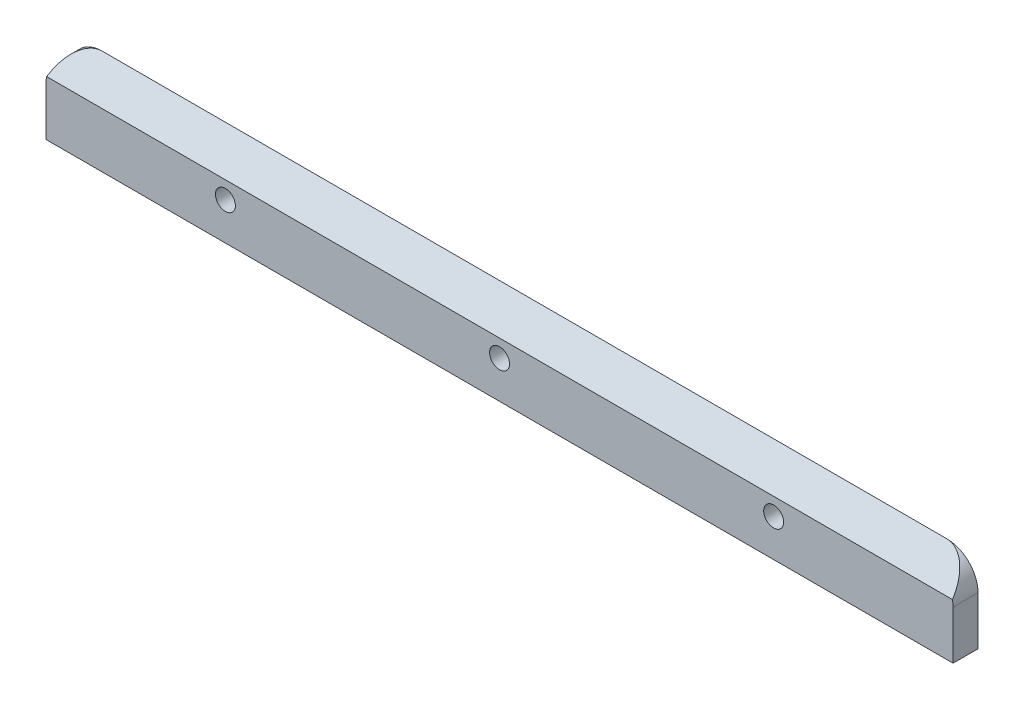
from build123d import *

# Parameters (mm, degrees)
SKETCH1_W                 = 2
SKETCH1_H                 = 6.4
BOSS_EXTRUDE1_DEPTH       = 36.4
FILLET3_R                 = 2.5
M2X0_4_TAPPED_HOLE1_D     = 1.6
M2X0_4_TAPPED_HOLE1_DEPTH = 3.6
M2X0_4_TAPPED_HOLE1_TIP   = 0.480688495
CUT_EXTRUDE7_DEPTH        = 37.595081637
CUT_EXTRUDE7_DEPTH_BACK   = 37.595081637


with BuildPart() as part:
    # Sketch1 → Boss-Extrude1 (new, symmetric)
    with BuildSketch(Plane(origin=(0, 0, 0), x_dir=(0, 0, -1), z_dir=(1, 0, 0))):
        with Locations((-1, 0)):
            Rectangle(SKETCH1_W, SKETCH1_H)
    extrude(amount=BOSS_EXTRUDE1_DEPTH, both=True)

    # Fillet3
    fillet3_edges = [part.edges().sort_by_distance(p)[0] for p in [
        (-36.4, 3.2, 1),
        (36.4, 3.2, 1),
    ]]
    fillet(fillet3_edges, radius=FILLET3_R)

    # M2x0.4 Tapped Hole1
    with Locations(Plane.XY.offset(2)):
        with Locations((-22, -0.2), (22, -0.2), (0, -0.2)):
            Hole(M2X0_4_TAPPED_HOLE1_D / 2, depth=M2X0_4_TAPPED_HOLE1_DEPTH)
            with Locations((0, 0, -(M2X0_4_TAPPED_HOLE1_DEPTH + M2X0_4_TAPPED_HOLE1_TIP / 2))):  # 118° drill point
                Cone(0, M2X0_4_TAPPED_HOLE1_D / 2, M2X0_4_TAPPED_HOLE1_TIP, mode=Mode.SUBTRACT)

    # Sketch14 → Cut-Extrude7 (cut, two sides: drawn at the far end of the back side and taken through both)
    with BuildSketch(Plane(origin=(0, 0, 0), x_dir=(0, 0, -1), z_dir=(1, 0, 0)).offset(-CUT_EXTRUDE7_DEPTH_BACK)):
        Polygon((0, 3.2), (-2, 3.2), (-2, 1.2), align=None)
    extrude(amount=CUT_EXTRUDE7_DEPTH + CUT_EXTRUDE7_DEPTH_BACK, mode=Mode.SUBTRACT)


solid = part.part
